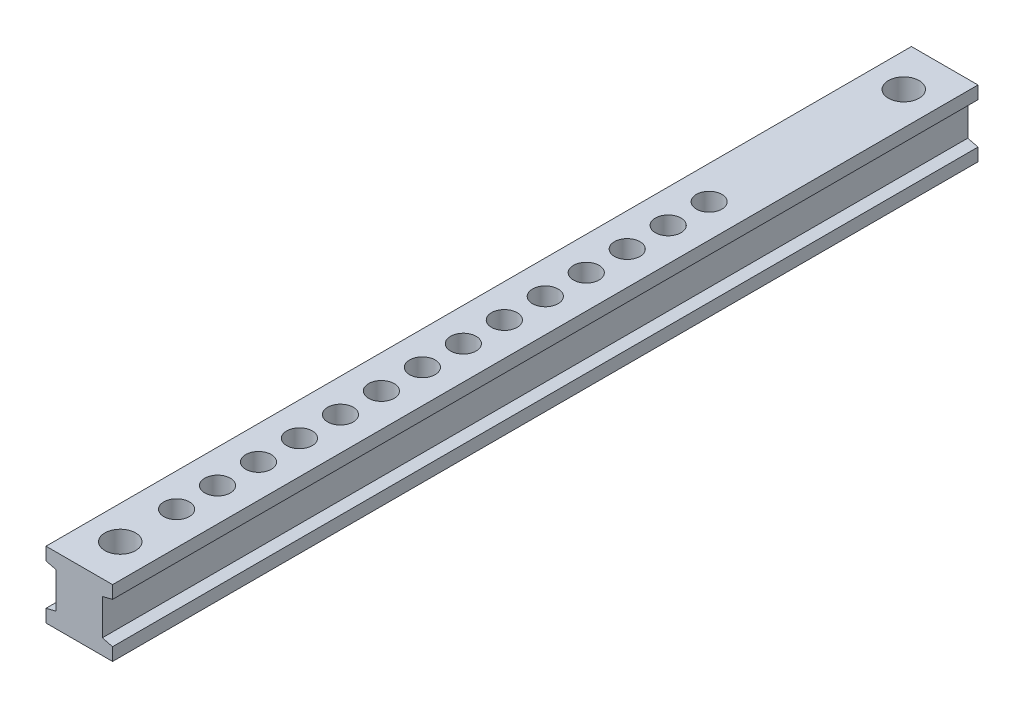
from build123d import *

# Parameters (mm, degrees)
BOSS_EXTRUDE1_DEPTH     = 84.5
CUT_EXTRUDE1_DEPTH      = 85.998529399
CUT_EXTRUDE1_DEPTH_BACK = 85.998529399
SKETCH2_R               = 3
SKETCH2_R_2             = 2.5


with BuildPart() as part:
    # Sketch1 → Boss-Extrude1 (new, symmetric)
    with BuildSketch(Plane.XY):
        Polygon((4.5, 3.5), (6.5, 4), (6.5, 6.5), (-6.5, 6.5), (-6.5, 4), (-4.5, 3.5), (-4.5, -3.5), (-6.5, -4), (-6.5, -6.5), (6.5, -6.5), (6.5, -4), (4.5, -3.5), align=None)
    extrude(amount=BOSS_EXTRUDE1_DEPTH, both=True)

    # Sketch2 → Cut-Extrude1 (cut, two sides: drawn at the far end of the back side and taken through both)
    with BuildSketch(Plane(origin=(0, 0, 0), x_dir=(1, 0, 0), z_dir=(0, 1, 0)).offset(-CUT_EXTRUDE1_DEPTH_BACK)):
        with Locations((0, 76.5)):
            Circle(SKETCH2_R)
        with Locations((0, -76.5)):
            Circle(SKETCH2_R)
        with Locations((0, -65.5)):
            Circle(SKETCH2_R_2)
        with Locations((0, -57.5)):
            Circle(SKETCH2_R_2)
        with Locations((0, -49.5)):
            Circle(SKETCH2_R_2)
        with Locations((0, -41.5)):
            Circle(SKETCH2_R_2)
        with Locations((0, -33.5)):
            Circle(SKETCH2_R_2)
        with Locations((0, -25.5)):
            Circle(SKETCH2_R_2)
        with Locations((0, -17.5)):
            Circle(SKETCH2_R_2)
        with Locations((0, -9.5)):
            Circle(SKETCH2_R_2)
        with Locations((0, -1.5)):
            Circle(SKETCH2_R_2)
        with Locations((0, 6.5)):
            Circle(SKETCH2_R_2)
        with Locations((0, 14.5)):
            Circle(SKETCH2_R_2)
        with Locations((0, 22.5)):
            Circle(SKETCH2_R_2)
        with Locations((0, 30.5)):
            Circle(SKETCH2_R_2)
        with Locations((0, 38.5)):
            Circle(SKETCH2_R_2)
    extrude(amount=CUT_EXTRUDE1_DEPTH + CUT_EXTRUDE1_DEPTH_BACK, mode=Mode.SUBTRACT)


solid = part.part
